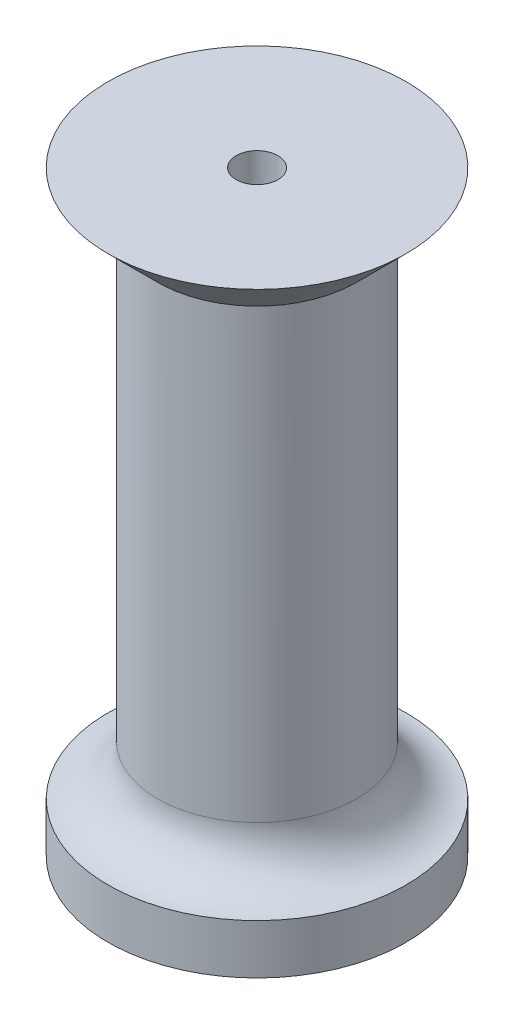
from build123d import *

# Parameters (mm, degrees)
FILLET1_R          = 5
CUT_EXTRUDE1_START = -3
CUT_EXTRUDE1_DEPTH = 3.4
SKETCH3_R          = 2.1
CUT_EXTRUDE2_DEPTH = 12
CHAMFER1_SIZE      = 5


# Read off the part's stored shape, not the designer's step: Revolve-Thin2
with BuildPart() as part:
    # Revolve-Thin2 outline → Revolve-Thin2 (revolve)
    with BuildSketch(Plane.XY):
        Polygon((0, 60), (0, 0), (15, 0), (15, 5), (10, 5), (10, 55), (15, 55), (15, 60), align=None)
    revolve(axis=Axis((0, 0, 0), (0, 1, 0)))

    # Fillet1
    fillet1_edges = [part.edges().sort_by_distance(p)[0] for p in [
        (-10, 5, 0),
    ]]
    fillet(fillet1_edges, radius=FILLET1_R - 0.0001)  # a hair under: the kernel refuses the full size

    # Sketch2 → Cut-Extrude1 (cut)
    with BuildSketch(Plane(origin=(0, 60, 0), x_dir=(1, 0, 0), z_dir=(0, 1, 0)).offset(CUT_EXTRUDE1_START)):
        Polygon((0, 4.099186911), (-3.55, 2.049593456), (-3.55, -2.049593456), (0, -4.099186911), (3.55, -2.049593456), (3.55, 2.049593456), align=None)
    extrude(amount=-CUT_EXTRUDE1_DEPTH, mode=Mode.SUBTRACT)

    # Sketch3 → Cut-Extrude2 (cut)
    with BuildSketch(Plane(origin=(0, 60, 0), x_dir=(1, 0, 0), z_dir=(0, 1, 0))):
        with Locations(Location((0, 0, 0), (0, 0, 270))):
            Circle(SKETCH3_R)
    extrude(amount=-CUT_EXTRUDE2_DEPTH, mode=Mode.SUBTRACT)

    # Chamfer1
    chamfer1_edges = [part.edges().sort_by_distance(p)[0] for p in [
        (-15, 55, 0),
    ]]
    chamfer(chamfer1_edges, length=CHAMFER1_SIZE - 0.0001)  # a hair under: the kernel refuses the full size


solid = part.part
